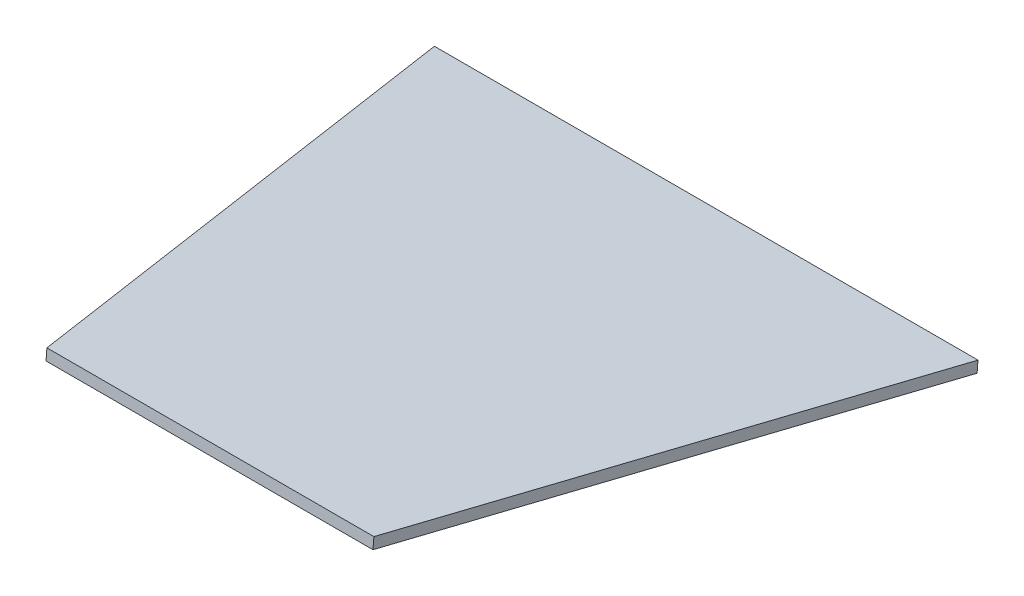
from build123d import *

# Parameters (mm, degrees)
BOSS_EXTRUDE1_DEPTH = 12.7


with BuildPart() as part:
    # Sketch1 → Boss-Extrude1 (new body)
    with BuildSketch(Plane(origin=(-0.000589677, -7356.681307698, 606.878154284), x_dir=(-0.9999999999999969, 7.961414168714261e-08, -6.567661367452003e-09), z_dir=(-7.988457756299226e-08, -0.9966146823530273, 0.08221420143970541))):
        Polygon((927.93235897, -1893.28840213), (1306.839320089, -1893.28840213), (1432.352062817, -1316.739819061), (802.419616241, -1316.739819061), align=None)
    extrude(amount=BOSS_EXTRUDE1_DEPTH)


solid = part.part
